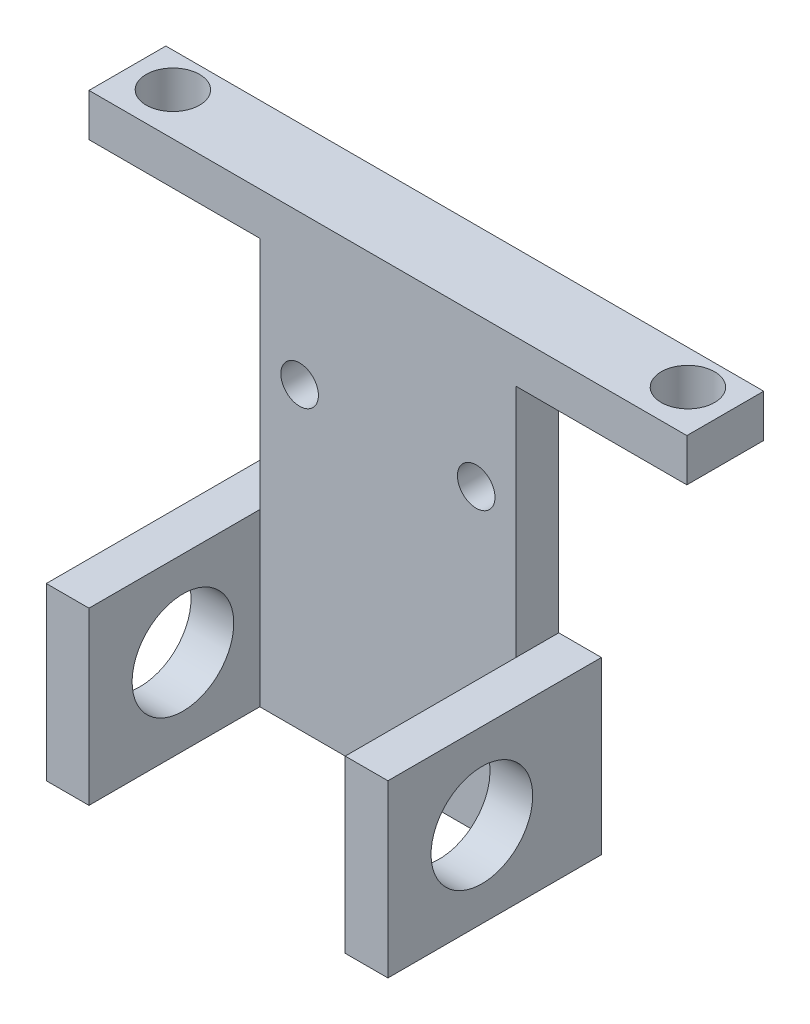
from build123d import *

# Parameters (mm, degrees)
SKETCH4_W             = 35.56
SKETCH4_H             = 4.572
BOSS_EXTRUDE3_DEPTH   = 2.54
SKETCH5_R             = 1.5875
LASER_PDB_HOLES_DEPTH = 19.105407921
SKETCH7_W             = 15.24
SKETCH7_H             = 24.13
BOSS_EXTRUDE5_DEPTH   = 2.54
SKETCH9_R             = 1.1176
CUT_EXTRUDE5_DEPTH    = 31.319770514
SKETCH10_W            = 12.7
SKETCH10_H            = 10.16
BOSS_EXTRUDE6_DEPTH   = 2.54
SKETCH11_R            = 3.0226
CUT_EXTRUDE6_DEPTH    = 39.958996599


with BuildPart() as part:
    # Sketch4 → Boss-Extrude3 (new body)
    with BuildSketch(Plane(origin=(0, 0, 0), x_dir=(1, 0, 0), z_dir=(0, 1, 0))):
        Rectangle(SKETCH4_W, SKETCH4_H)
    extrude(amount=BOSS_EXTRUDE3_DEPTH)

    # Sketch5 → Laser PDB holes (cut, through all)
    with BuildSketch(Plane.XZ):
        with Locations((-15.3162, -0.2413)):
            Circle(SKETCH5_R)
        with Locations((15.3162, -0.2413)):
            Circle(SKETCH5_R)
    extrude(amount=-LASER_PDB_HOLES_DEPTH, mode=Mode.SUBTRACT)

    # Sketch7 → Boss-Extrude5 (add)
    with BuildSketch(Plane(origin=(0, -2.032, 2.286), x_dir=(1, 0, 0), z_dir=(0, 0, -1))):
        with Locations((0, 10.033)):
            Rectangle(SKETCH7_W, SKETCH7_H)
    extrude(amount=BOSS_EXTRUDE5_DEPTH)

    # Sketch9 → Cut-Extrude5 (cut, through all)
    with BuildSketch(Plane.XY.offset(2.286)):
        with Locations((-5.25145, -6.35)):
            Circle(SKETCH9_R)
        with Locations((5.25145, -6.35)):
            Circle(SKETCH9_R)
    extrude(amount=-CUT_EXTRUDE5_DEPTH, mode=Mode.SUBTRACT)

    # Sketch10 → Boss-Extrude6 (add)
    with BuildSketch(Plane(origin=(7.62, 0, 0), x_dir=(0, 0, -1), z_dir=(1, 0, 0))):
        with Locations((-6.096, -19.05)):
            Rectangle(SKETCH10_W, SKETCH10_H)
    boss_extrude6 = extrude(amount=BOSS_EXTRUDE6_DEPTH)

    # Mirror1: Boss-Extrude6 across plane
    add(boss_extrude6.mirror(Plane(origin=(0, 0, 0), x_dir=(0, 0, 1), z_dir=(1, 0, 0))))

    # Sketch11 → Cut-Extrude6 (cut, through all)
    with BuildSketch(Plane(origin=(10.16, 0, 0), x_dir=(0, 0, -1), z_dir=(1, 0, 0))):
        with Locations((-6.858, -19.05)):
            Circle(SKETCH11_R)
    extrude(amount=-CUT_EXTRUDE6_DEPTH, mode=Mode.SUBTRACT)


solid = part.part
